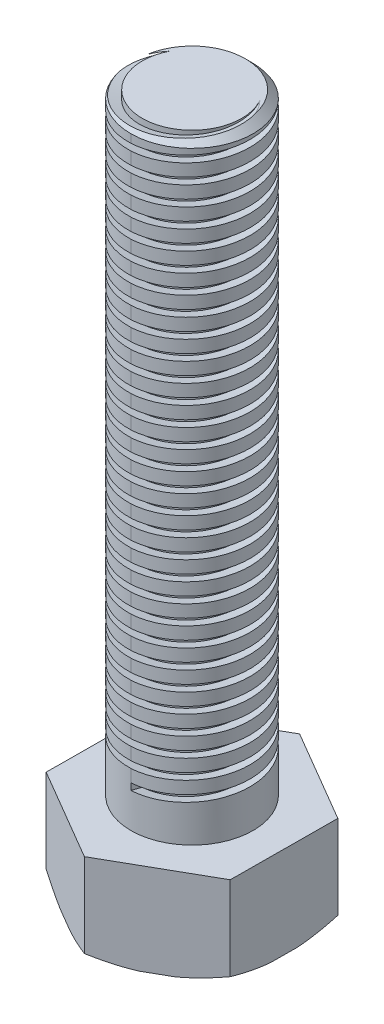
from build123d import *

# Parameters (mm, degrees)
BOSS_EXTRUDE1_DEPTH = 6
SKETCH2_R           = 4
BOSS_EXTRUDE2_DEPTH = 40
SKETCH3_OUTSIDE_W   = 162.652
SKETCH3_OUTSIDE_H   = 164.484
SKETCH3_OUTSIDE_R   = 6.123688047
CUT_EXTRUDE1_DEPTH  = 40
CUT_EXTRUDE1_DRAFT  = -60
CHAMFER1_SIZE       = 0.5
CUT_SWEEP3_PITCH    = 1.25


with BuildPart() as part:
    # Sketch1 → Boss-Extrude1 (new body)
    with BuildSketch(Plane(origin=(0, 0, 0), x_dir=(1, 0, 0), z_dir=(0, 1, 0))):
        Polygon((6.039925478, -3.538542199), (6.084430175, 3.461457801), (0.044504698, 7), (-6.039925478, 3.538542199), (-6.084430175, -3.461457801), (-0.044504698, -7), align=None)
    extrude(amount=-BOSS_EXTRUDE1_DEPTH)

    # Sketch2 → Boss-Extrude2 (add)
    with BuildSketch(Plane(origin=(0, 0, 0), x_dir=(1, 0, 0), z_dir=(0, 1, 0))):
        with Locations(Location((0, 0, 0), (0, 0, 270))):
            Circle(SKETCH2_R)
    extrude(amount=BOSS_EXTRUDE2_DEPTH)


with BuildPart() as cut_extrude1_tool:
    # Sketch3 outside → Cut-Extrude1 (with draft: the straight prism first)
    with BuildSketch(Plane.XZ.offset(6)):
        Rectangle(SKETCH3_OUTSIDE_W, SKETCH3_OUTSIDE_H)
        Circle(SKETCH3_OUTSIDE_R, mode=Mode.SUBTRACT)
    extrude(amount=-CUT_EXTRUDE1_DEPTH)
    # Cut-Extrude1: the draft: its side faces are tilted about the plane it starts from
    cut_extrude1_sides = [cut_extrude1_tool.faces().sort_by_distance(p)[0] for p in [
        (0, 14, -82.242),
        (81.326, 14, 0),
        (0, 14, 82.242),
        (-81.326, 14, 0),
        (-6.123688047, 14, 0),
    ]]
    draft(cut_extrude1_sides, Plane.XZ.offset(6), CUT_EXTRUDE1_DRAFT)


with BuildPart() as part_1:
    add(part.part)

    # Cut-Extrude1: cut by cut_extrude1_tool
    add(cut_extrude1_tool.part, mode=Mode.SUBTRACT)

    # Chamfer1
    chamfer1_edges = [part_1.edges().sort_by_distance(p)[0] for p in [
        (0, 40, -4),
    ]]
    chamfer(chamfer1_edges, length=CHAMFER1_SIZE)

    # Cut-Sweep3: arcs per turn and ends read off the stored shape
    # Cut-Sweep3: the profile of Sketch5 profile screwed along a right-hand helix through 31 turns, 8 arcs to a turn; built about Z, then put on its axis
    cut_sweep3_z = Axis((0, 0, 0), (0, 0, 1))
    cut_sweep3_corners = [(4.0003, 0, -1.462434523), (3.25571557, 0, -1.65499715), (3.25571557, 0, -0.832512108), (4.0003, 0, -1.025074735)]
    with BuildLine(mode=Mode.PRIVATE) as cut_sweep3_profile:
        Line(cut_sweep3_corners[0], cut_sweep3_corners[1])
        Line(cut_sweep3_corners[1], cut_sweep3_corners[2])
        Line(cut_sweep3_corners[2], cut_sweep3_corners[3])
        Line(cut_sweep3_corners[3], cut_sweep3_corners[0])
    cut_sweep3_cap = Face(cut_sweep3_profile.wire())
    cut_sweep3_turn_angles = [0, 22.5, 45, 67.5, 90, 112.5, 135, 157.5, 180, 202.5, 225, 247.5, 270, 292.5, 315, 337.5, 360]
    cut_sweep3_turn_weights = [1, 0.9238795325112867, 1, 0.9238795325112867, 1, 0.9238795325112867, 1, 0.9238795325112867, 1, 0.9238795325112867, 1, 0.9238795325112867, 1, 0.9238795325112867, 1, 0.9238795325112867, 1]
    cut_sweep3_turn_rails = [Edge.make_bspline([Vector(p[0], p[1], 0).rotate(cut_sweep3_z, cut_sweep3_turn_angles[k]) / cut_sweep3_turn_weights[k] + Vector(0, 0, p[2] + CUT_SWEEP3_PITCH * cut_sweep3_turn_angles[k] / 360) for k in range(17)], [0, 0, 0, 1, 1, 2, 2, 3, 3, 4, 4, 5, 5, 6, 6, 7, 7, 8, 8, 8], 2, cut_sweep3_turn_weights) for p in cut_sweep3_corners]
    cut_sweep3_turn_sides = [Face.make_surface_from_curves(cut_sweep3_turn_rails[p[0]], cut_sweep3_turn_rails[p[1]]) for p in [(0, 1), (1, 2), (2, 3), (3, 0)]]
    cut_sweep3 = Plane(origin=(0, 40, 0), x_dir=(0, 0, 1), z_dir=(0, -1, 0)) * Solid(Shell([*[p.moved(Location((0, 0, CUT_SWEEP3_PITCH * i))) for i in range(31) for p in cut_sweep3_turn_sides], cut_sweep3_cap, cut_sweep3_cap.rotate(cut_sweep3_z, 11160).moved(Location((0, 0, CUT_SWEEP3_PITCH * 11160 / 360)))]))
    add(cut_sweep3, mode=Mode.SUBTRACT)


solid = part_1.part
